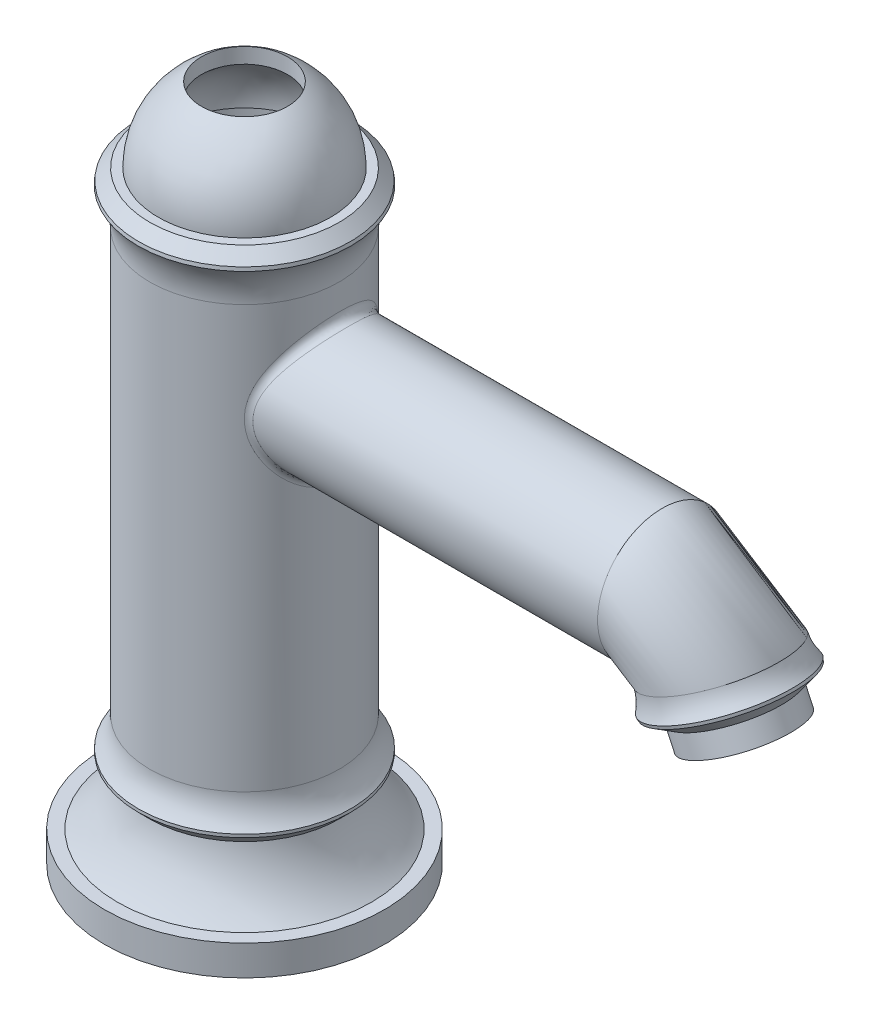
from build123d import *

# Parameters (mm, degrees)
SWEEP1_PROFILE_R     = 15
CHAMFER1_SIZE        = 0.5
CHAMFER1_SIZE_2      = 0.589255651
CUT_SWEEP1_PROFILE_R = 10
SKETCH39_R           = 10.414
CUT_EXTRUDE1_DEPTH   = 12.790226
FILLET1_R            = 2
CUT_EXTRUDE3_REACH   = 209.074
SKETCH66_R           = 19
SKETCH67_R           = 10
CUT_EXTRUDE4_DEPTH   = 193.040325543


with BuildPart() as part:
    # Sketch1 → Revolve1 (revolve)
    with BuildSketch(Plane.XY, mode=Mode.PRIVATE) as revolve1_sk:
        with BuildLine():
            Line((0, 0), (32.5, 0))
            Line((32.5, 0), (32.5, 7))
            Line((32.5, 7), (29.5, 7))
            ThreePointArc((29.5, 7), (24.607160678, 12.840669622), (22, 20))
            Line((22, 20), (25, 23))
            ThreePointArc((25, 23), (22.781598043, 26.192113447), (22, 30))
            Line((22, 30), (22, 128))
            ThreePointArc((22, 128), (22.769750529, 132.74341649), (25, 137))
            Line((25, 137), (22, 140))
            Line((22, 140), (0, 140))
            Line((0, 140), (0, 0))
        make_face()
    revolve(revolve1_sk.sketch.rotate(Axis((0, 140, 0), (0, -1, 0)), 90), axis=Axis((0, 140, 0), (0, -1, 0)))

    # Sweep1: sweep along a path in Sketch3
    with BuildLine(Plane.XY) as sweep1_path:
        Line((0, 105), (97, 105))
        ThreePointArc((97, 105), (105.059494125, 102.650871687), (110.594616806, 96.339273926))
    # Sweep1 profile (on start of the path) → Sweep1 (sweep)
    with BuildSketch(Plane(origin=(0, 105, 0), x_dir=(0, 1, 0), z_dir=(1, 0, 0))):
        Circle(SWEEP1_PROFILE_R)
    sweep(path=sweep1_path.line)

    # Sketch16 → Revolve3 (revolve)
    with BuildSketch(Plane.XY, mode=Mode.PRIVATE) as revolve3_sk:
        with BuildLine():
            Line((116, 84.747392258), (126.875693444, 89.818811398))
            Line((126.875693444, 89.818811398), (124.762602136, 94.350350334))
            Line((124.762602136, 94.350350334), (127.650557609, 98.620990158))
            ThreePointArc((127.650557609, 98.620990158), (125.644403351, 100.414758676), (124.189233611, 102.678547852))
            Line((124.189233611, 102.678547852), (110.594616806, 96.339273926))
            Line((110.594616806, 96.339273926), (116, 84.747392258))
        make_face()
    revolve(revolve3_sk.sketch.rotate(Axis((110.594616806, 96.339273926, 0), (0.4226182617406933, -0.9063077870366529, 0)), 180), axis=Axis((110.594616806, 96.339273926, 0), (0.4226182617406933, -0.9063077870366529, 0)))

    # Chamfer1
    # the kernel refuses this chamfer: 0.589255651, 0.5, 0.488240397 mm, written as the material it takes off along each edge
    with BuildSketch(Plane(origin=(0, 23, 0), x_dir=(0, 0, 1), z_dir=(1, 0, 0))) as chamfer1_piece_1:
        with BuildLine():
            Line((25 - CHAMFER1_SIZE * 0.707106781187, CHAMFER1_SIZE * 0.707106781187), (24.646446609, -0.35462907))
            ThreePointArc((24.646446609, -0.35462907), (24.815923099, -0.18004714), (25, 0))
            Line((25, 0), (25 - CHAMFER1_SIZE * 0.707106781187, CHAMFER1_SIZE * 0.707106781187))
        make_face()
    revolve(axis=Axis((0, 23, 0), (0, -1, 0)), mode=Mode.SUBTRACT)
    with BuildSketch(Plane(origin=(112.766965477, 91.680657166, 0), x_dir=(-0.9063077870366528, -0.42261826174069334, 0), z_dir=(0, 0, 1))) as chamfer1_piece_2:
        with BuildLine():
            Line((16.169745555, -0.446963708), (16.422226913 - CHAMFER1_SIZE * 0.857777308691, CHAMFER1_SIZE * 0.514021486608))
            Line((16.422226913 - CHAMFER1_SIZE * 0.857777308691, CHAMFER1_SIZE * 0.514021486608), (16.422226913, 0))
            ThreePointArc((16.422226913, 0), (16.289550416, -0.228181881), (16.169745555, -0.446963708))
        make_face()
    revolve(axis=Axis((112.766965477, 91.680657166, 0), (0.4226182617406933, -0.9063077870366529, 0)), mode=Mode.SUBTRACT)
    with BuildSketch(Plane(origin=(0, 137, 0), x_dir=(0, 0, 1), z_dir=(1, 0, 0))) as chamfer1_piece_3:
        with BuildLine():
            Line((24.701725164, 0.412076149), (25 - CHAMFER1_SIZE_2 * 0.707106781173, -CHAMFER1_SIZE_2 * 0.707106781173))
            Line((25 - CHAMFER1_SIZE_2 * 0.707106781173, -CHAMFER1_SIZE_2 * 0.707106781173), (25, 0))
            ThreePointArc((25, 0), (24.844145725, 0.211643678), (24.701725164, 0.412076149))
        make_face()
    revolve(axis=Axis((0, 137, 0), (0, -1, 0)), mode=Mode.SUBTRACT)

    # Cut-Sweep1: sweep along a path in Sketch3<3>
    with BuildLine(Plane.XY) as cut_sweep1_path:
        Line((0, 105), (97, 105))
        ThreePointArc((97, 105), (105.059494125, 102.650871687), (110.594616806, 96.339273926))
    # Cut-Sweep1 profile (on start of the path) → Cut-Sweep1 (sweep, cut)
    with BuildSketch(Plane(origin=(0, 105, 0), x_dir=(0, 1, 0), z_dir=(1, 0, 0))):
        Circle(CUT_SWEEP1_PROFILE_R)
    sweep(path=cut_sweep1_path.line, mode=Mode.SUBTRACT)

    # Sketch39 → Cut-Extrude1 (cut)
    with BuildSketch(Plane(origin=(-11.741815816, 25.180405276, 0), x_dir=(-0.9063077870366528, -0.4226182617406934, 0), z_dir=(0.42261826174069334, -0.9063077870366527, 0))):
        with Locations(Location((-140.947498899, 0, 0), (0, 0, 180))):
            Circle(SKETCH39_R)
    extrude(amount=-CUT_EXTRUDE1_DEPTH, mode=Mode.SUBTRACT)

    # Fillet1
    fillet1_edges = [part.edges().sort_by_distance(p)[0] for p in [
        (22, 90, 0),
    ]]
    fillet(fillet1_edges, radius=FILLET1_R)

    # Sketch65 → Revolve4 (revolve)
    with BuildSketch(Plane.XY):
        with BuildLine():
            Line((20, 140), (17, 140))
            ThreePointArc((17, 140), (12.02081528, 152.02081528), (0, 157))
            Line((0, 157), (0, 160))
            ThreePointArc((0, 160), (14.142135624, 154.142135624), (20, 140))
        make_face()
    revolve(axis=Axis((0, 160, 0), (0, -1, 0)))

    # Cut-Extrude3: up to this face of the body (flat: up to its plane)
    cut_extrude3_end = Plane(part.part.faces().sort_by_distance((0, 140, -21.377746033))[0])
    # Sketch66 → Cut-Extrude3 (cut, up to the picked face)
    with BuildSketch(Plane.XZ, mode=Mode.PRIVATE) as cut_extrude3_sk1:
        with Locations(Location((0, 0, 0), (0, 0, 270))):
            Circle(SKETCH66_R)
    cut_extrude3_tool1 = split(extrude(cut_extrude3_sk1.sketch, amount=-CUT_EXTRUDE3_REACH, mode=Mode.PRIVATE), bisect_by=cut_extrude3_end, keep=Keep.BOTH, mode=Mode.PRIVATE)
    add(cut_extrude3_tool1.solids().sort_by(Axis((0, 0, 0), (0, 1, 0)))[0], mode=Mode.SUBTRACT)

    # Sketch67 → Cut-Extrude4 (cut, through all)
    with BuildSketch(Plane(origin=(0, 140, 0), x_dir=(1, 0, 0), z_dir=(0, 1, 0))):
        with Locations(Location((0, 0, 0), (0, 0, 90))):
            Circle(SKETCH67_R)
    extrude(amount=CUT_EXTRUDE4_DEPTH, mode=Mode.SUBTRACT)


solid = part.part
